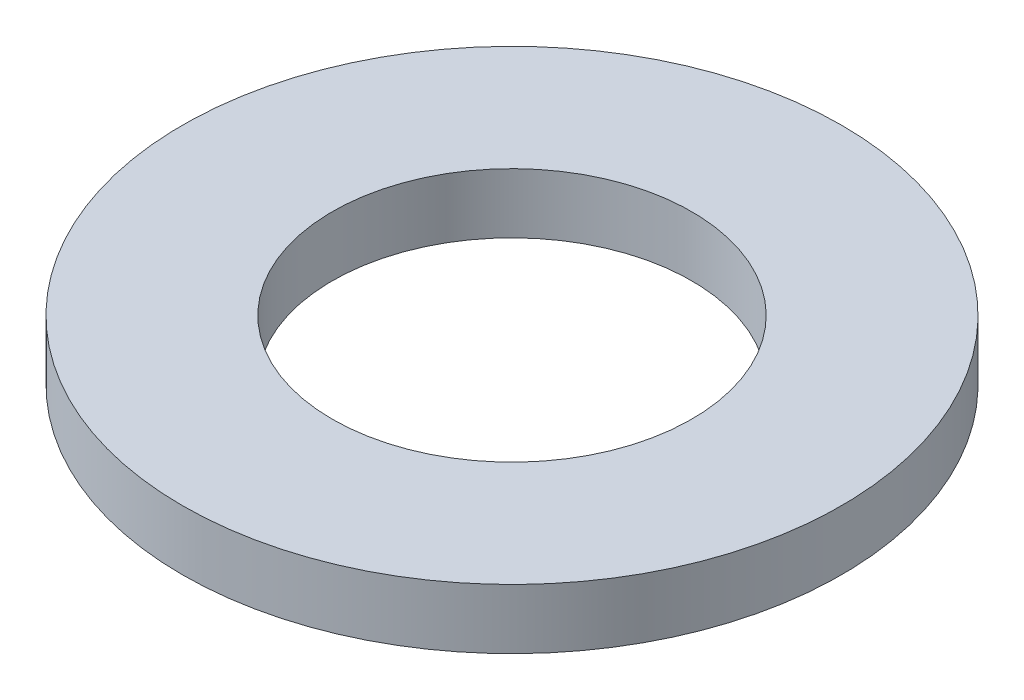
from build123d import *

# Parameters (mm, degrees)
SZKIC1_R                    = 11
SZKIC1_R_2                  = 6
DODANIE_WYCI_GNI_CIE1_DEPTH = 2


with BuildPart() as part:
    # Szkic1 → Dodanie-wyciągnięcie1 (new body)
    with BuildSketch(Plane(origin=(0, 0, 0), x_dir=(1, 0, 0), z_dir=(0, 1, 0))):
        Circle(SZKIC1_R)
        Circle(SZKIC1_R_2, mode=Mode.SUBTRACT)
    extrude(amount=DODANIE_WYCI_GNI_CIE1_DEPTH)


solid = part.part
